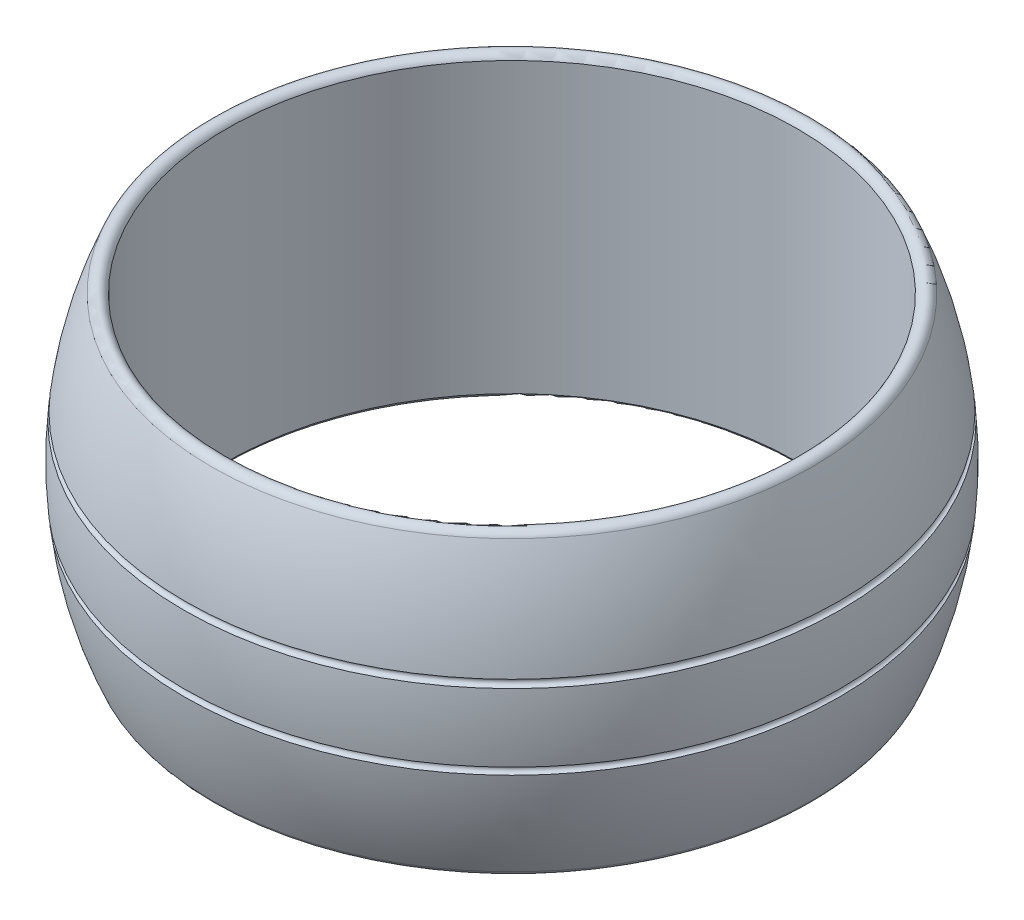
from build123d import *


with BuildPart() as part:
    # Sketch1 → Revolve1 (revolve)
    with BuildSketch(Plane.XY):
        with BuildLine():
            Line((7.55, 3.817501341), (7.55, -3.817501341))
            ThreePointArc((7.55, -3.817501341), (7.75, -3.95), (7.95, -3.817501341))
            ThreePointArc((7.95, -3.817501341), (8.404567833, -2.484180776), (8.663068845, -1.099423444))
            ThreePointArc((8.663068845, -1.099423444), (8.574314752, -0.989785119), (8.68349834, -0.900472213))
            ThreePointArc((8.68349834, -0.900472213), (8.725, 0), (8.68349834, 0.900472213))
            ThreePointArc((8.68349834, 0.900472213), (8.574314752, 0.989785119), (8.663068845, 1.099423444))
            ThreePointArc((8.663068845, 1.099423444), (8.404567833, 2.484180776), (7.95, 3.817501341))
            ThreePointArc((7.95, 3.817501341), (7.75, 3.95), (7.55, 3.817501341))
        make_face()
    revolve(axis=Axis((0, 3.817501341, 0), (0, -1, 0)))


solid = part.part
